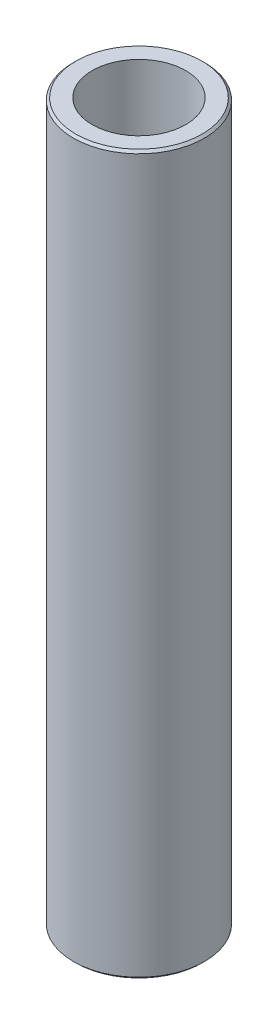
from build123d import *

# Parameters (mm, degrees)
SKETCH1_R           = 52.5
BOSS_EXTRUDE1_DEPTH = 574.835952545
SKETCH2_R           = 37.494176148
CUT_EXTRUDE1_DEPTH  = 580.610966372
CHAMFER1_SIZE       = 1.878906448


with BuildPart() as part:
    # Sketch1 → Boss-Extrude1 (new body)
    with BuildSketch(Plane(origin=(0, 0, 0), x_dir=(1, 0, 0), z_dir=(0, 1, 0))):
        Circle(SKETCH1_R)
    extrude(amount=BOSS_EXTRUDE1_DEPTH)

    # Sketch2 → Cut-Extrude1 (cut, through all)
    with BuildSketch(Plane(origin=(0, 0, 0), x_dir=(1, 0, 0), z_dir=(0, 1, 0))):
        Circle(SKETCH2_R)
    extrude(amount=CUT_EXTRUDE1_DEPTH, mode=Mode.SUBTRACT)

    # Chamfer1
    chamfer1_edges = [part.edges().sort_by_distance(p)[0] for p in [
        (-52.5, 574.835952545, 0),
        (-52.5, 0, 0),
    ]]
    chamfer(chamfer1_edges, length=CHAMFER1_SIZE)


solid = part.part
